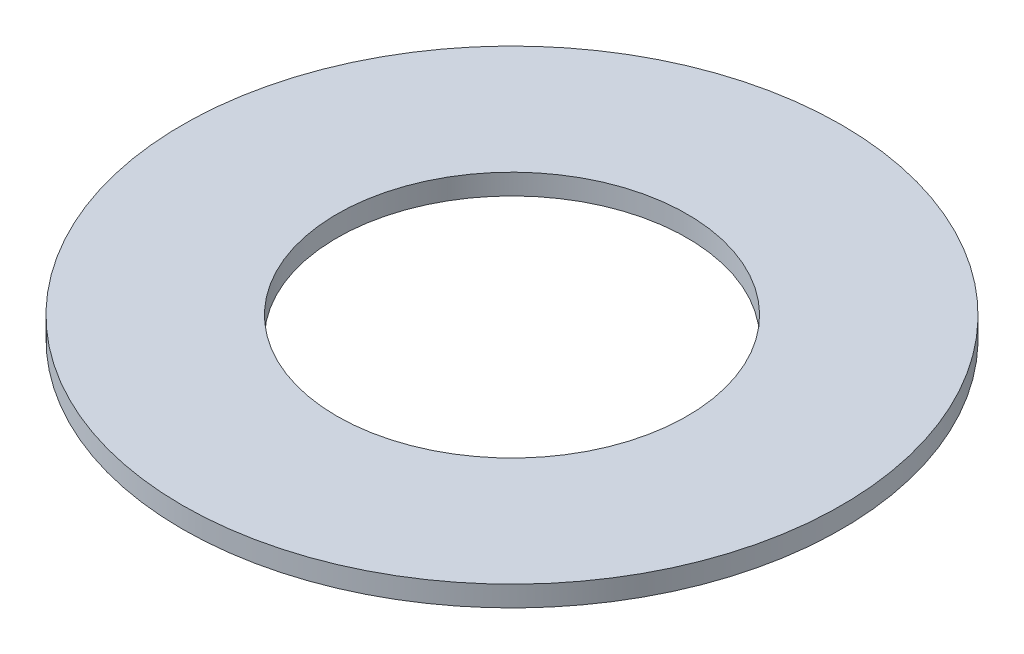
from build123d import *

# Parameters (mm, degrees)
SKETCH1_R           = 80
BOSS_EXTRUDE1_DEPTH = 5
SKETCH2_R           = 42.5
CUT_EXTRUDE1_DEPTH  = 114.247516529


with BuildPart() as part:
    # Sketch1 → Boss-Extrude1 (new body)
    with BuildSketch(Plane(origin=(0, 0, 0), x_dir=(1, 0, 0), z_dir=(0, 1, 0))):
        Circle(SKETCH1_R)
    extrude(amount=BOSS_EXTRUDE1_DEPTH)

    # Sketch2 → Cut-Extrude1 (cut, through all)
    with BuildSketch(Plane(origin=(0, 0, 0), x_dir=(1, 0, 0), z_dir=(0, 1, 0))):
        Circle(SKETCH2_R)
    extrude(amount=CUT_EXTRUDE1_DEPTH, mode=Mode.SUBTRACT)


solid = part.part
